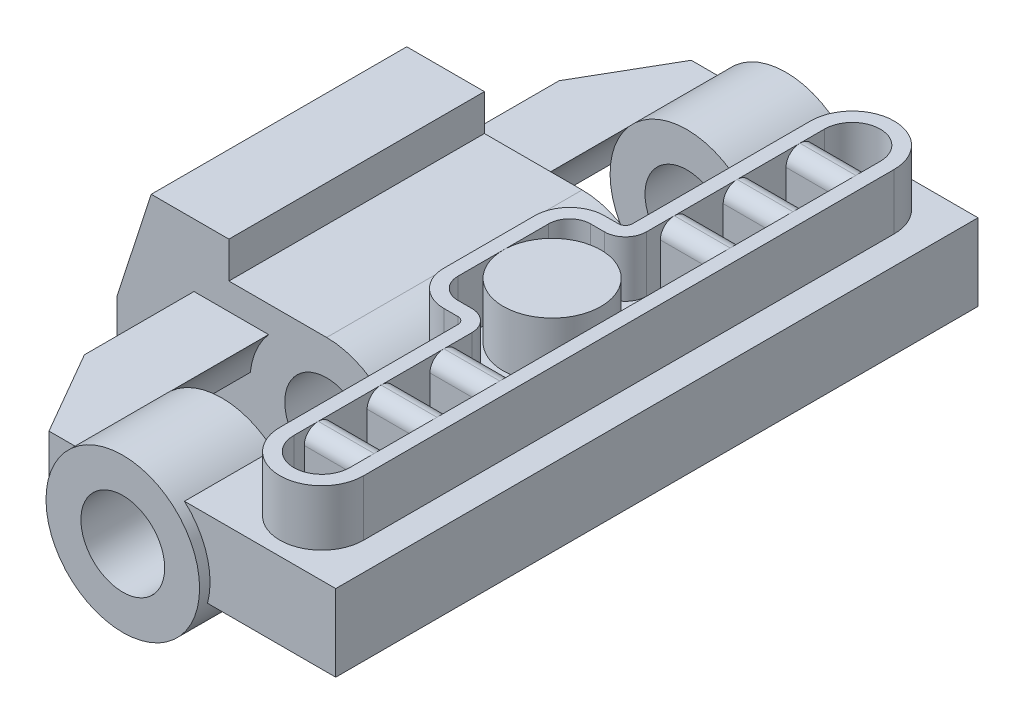
from build123d import *

# Parameters (mm, degrees)
BOSS_EXTRUDE1_DEPTH    = 9.15
BOSS_EXTRUDE2_DEPTH    = 3
BOSS_EXTRUDE3_START    = -23
SKETCH4_R              = 5.5
BOSS_EXTRUDE3_DEPTH    = 23.75
MOVE_START             = 3.6
MOVE_FACE1_OUTLINE_W   = 12.5
MOVE_FACE1_OUTLINE_H   = 46
MOVE_FACE1_DEPTH       = 0.5
MOVE_START_2           = -1.4
MOVE_FACE2_OUTLINE_W   = 10.5
MOVE_FACE2_OUTLINE_H   = 46
MOVE_FACE2_DEPTH       = 2
SKETCH7_R              = 5.5
CUT_EXTRUDE1_DEPTH     = 7.5
HOLE2_START            = -23.75
HOLE2_OUTLINE_R        = 3
HOLE2_DEPTH            = 47.5
BOSS_EXTRUDE4_REACH    = 35.801
SKETCH10_W             = 4
SKETCH10_H             = 11.5
FILLET1_R              = 2.5
FILLET3_R              = 0.5
CUT_EXTRUDE2_DEPTH     = 4
SKETCH12_W             = 6
SKETCH12_H             = 2
BOSS_EXTRUDE5_DEPTH    = 4
FILLET2_R              = 1
LPATTERN2_COUNT        = 3
LPATTERN2_PITCH        = 4.5
FILLET2_OF_LPATTERN2_R = 1
SKETCH13_R             = 3.5
BOSS_EXTRUDE13_DEPTH   = 4
MIRROR1_START          = 7.5
MIRROR1_DEPTH          = 4
MIRROR1_START_2        = 9.15
MIRROR1_2_OUTLINE_R    = 3
MIRROR1_2_DEPTH        = 7.5


# Read off the part's stored shape, not the designer's step: Move Face1, Move Face2, Hole2, Mirror1
# Some blends are built 0.0001 mm under size
with BuildPart() as part:
    # Sketch1 → Boss-Extrude1 (new, symmetric)
    with BuildSketch(Plane.XY):
        with BuildLine():
            Line((-4.4, -5.5), (0, -5.5))
            ThreePointArc((0, -5.5), (5.5, 0), (0, 5.5))
            Line((0, 5.5), (-7, 5.5))
            Line((-7, 5.5), (-7, 8.1))
            Line((-7, 8.1), (-12.563102278, 8.1))
            Line((-12.563102278, 8.1), (-15, 0.6))
            Line((-15, 0.6), (-15, -8.830934004))
            Line((-15, -8.830934004), (-4.4, -10.7))
            Line((-4.4, -10.7), (-4.4, -5.5))
        make_face()
    extrude(amount=BOSS_EXTRUDE1_DEPTH, both=True)

    # Sketch3 → Boss-Extrude2 (add)
    with BuildSketch(Plane(origin=(0, 0.6, 0), x_dir=(0, 0, -1), z_dir=(0, 1, 0))):
        Polygon((17, 9.5), (-17, 9.5), (-23, 6.035898385), (-23, -14.5), (23, -14.5), (23, 6.035898385), align=None)
    extrude(amount=BOSS_EXTRUDE2_DEPTH)

    # Sketch4 → Boss-Extrude3 (add, symmetric)
    with BuildSketch(Plane(origin=(0, 0, -23), x_dir=(-1, 0, 0), z_dir=(0, 0, -1)).offset(BOSS_EXTRUDE3_START)):
        with Locations(Location((0, 0, 0), (0, 0, 180))):
            Circle(SKETCH4_R)
    extrude(amount=BOSS_EXTRUDE3_DEPTH, both=True)

    # Move Face1 outline → Move Face1 (add)
    with BuildSketch(Plane(origin=(0, 0, 0), x_dir=(1, 0, 0), z_dir=(0, 1, 0)).offset(MOVE_START)):
        with Locations((8.25, 0)):
            Rectangle(MOVE_FACE1_OUTLINE_W, MOVE_FACE1_OUTLINE_H)
    extrude(amount=MOVE_FACE1_DEPTH)

    # Move Face2 outline → Move Face2 (add)
    with BuildSketch(Plane(origin=(0, 0, 0), x_dir=(1, 0, 0), z_dir=(0, 1, 0)).offset(MOVE_START_2)):
        with Locations((9.25, 0)):
            Rectangle(MOVE_FACE2_OUTLINE_W, MOVE_FACE2_OUTLINE_H)
    extrude(amount=MOVE_FACE2_DEPTH)

    # Sketch7 → Cut-Extrude1 (cut)
    with BuildSketch(Plane(origin=(0, 0, -9.15), x_dir=(-1, 0, 0), z_dir=(0, 0, -1))):
        with Locations(Location((0, 0, 0), (0, 0, 6.262913126))):
            Circle(SKETCH7_R)
    extrude(amount=CUT_EXTRUDE1_DEPTH, mode=Mode.SUBTRACT)

    # Hole2 outline → Hole2 (cut)
    with BuildSketch(Plane.XY.offset(HOLE2_START)):
        Circle(HOLE2_OUTLINE_R)
    extrude(amount=HOLE2_DEPTH, mode=Mode.SUBTRACT)

    # Boss-Extrude4: up to this face of the body (flat: up to its plane)
    boss_extrude4_end = Plane(part.part.faces().sort_by_distance((9.083030278, 4.1, 0))[0])
    # Sketch10 → Boss-Extrude4 (add, up to the picked face)
    with BuildSketch(Plane(origin=(0, 8.1, 0), x_dir=(1, 0, 0), z_dir=(0, 1, 0)), mode=Mode.PRIVATE) as boss_extrude4_sk1:
        with BuildLine():
            Line((12.5, -19), (12.5, 19))
            ThreePointArc((12.5, 19), (9.5, 22), (6.5, 19))
            Line((6.5, 19), (6.5, 5.75))
            Line((6.5, 5.75), (10.5, 5.75))
            Line((10.5, 5.75), (10.5, -5.75))
            Line((10.5, -5.75), (6.5, -5.75))
            Line((6.5, -5.75), (6.5, -19))
            ThreePointArc((6.5, -19), (9.5, -22), (12.5, -19))
        make_face()
    boss_extrude4_tool1 = split(extrude(boss_extrude4_sk1.sketch, amount=-BOSS_EXTRUDE4_REACH, mode=Mode.PRIVATE), bisect_by=boss_extrude4_end, keep=Keep.BOTH, mode=Mode.PRIVATE)
    # Sketch10 → Boss-Extrude4 (add, up to the picked face)
    with BuildSketch(Plane(origin=(0, 8.1, 0), x_dir=(1, 0, 0), z_dir=(0, 1, 0)), mode=Mode.PRIVATE) as boss_extrude4_sk2:
        with Locations((8.5, 0)):
            Rectangle(SKETCH10_W, SKETCH10_H)
    boss_extrude4_tool2 = split(extrude(boss_extrude4_sk2.sketch, amount=-BOSS_EXTRUDE4_REACH, mode=Mode.PRIVATE), bisect_by=boss_extrude4_end, keep=Keep.BOTH, mode=Mode.PRIVATE)
    # Sketch10 → Boss-Extrude4 (add, up to the picked face)
    with BuildSketch(Plane(origin=(0, 8.1, 0), x_dir=(1, 0, 0), z_dir=(0, 1, 0)), mode=Mode.PRIVATE) as boss_extrude4_sk3:
        with Locations((4.5, 0)):
            Rectangle(SKETCH10_W, SKETCH10_H)
    boss_extrude4_tool3 = split(extrude(boss_extrude4_sk3.sketch, amount=-BOSS_EXTRUDE4_REACH, mode=Mode.PRIVATE), bisect_by=boss_extrude4_end, keep=Keep.BOTH, mode=Mode.PRIVATE)
    add(boss_extrude4_tool1.solids().sort_by(Axis((12.055928, 8.1, 0), (0, -1, 0)))[0])
    add(boss_extrude4_tool2.solids().sort_by(Axis((8.5, 8.1, 0), (0, -1, 0)))[0])
    add(boss_extrude4_tool3.solids().sort_by(Axis((4.5, 8.1, 0), (0, -1, 0)))[0])

    # Fillet1
    # the kernel refuses this fillet: 2.5 mm, written as the material it takes off along each edge
    with BuildSketch(Plane(origin=(2.5, 14.35, -5.75), x_dir=(1, 0, 0), z_dir=(0, -1, 0))) as fillet1_piece_1_section:
        with BuildLine():
            CenterArc((FILLET1_R, FILLET1_R), FILLET1_R, 180, 90)
            Line((0, FILLET1_R), (0, 0))
            Line((0, 0), (FILLET1_R, 0))
        make_face()
    fillet1_piece_1 = extrude(amount=15.701020514, mode=Mode.PRIVATE)
    fillet1_piece_1 = fillet1_piece_1 - Plane(origin=(0, 0, -5.193529693), x_dir=(0, -1, 0), z_dir=(0, 0, 1)) * Cylinder(5.5, 42, mode=Mode.PRIVATE)
    fillet1_piece_1 = split(fillet1_piece_1, bisect_by=Plane(origin=(3.08088975, 4.1, -5.193529693), z_dir=(0, 1, 0)), keep=Keep.TOP, mode=Mode.PRIVATE)
    add(fillet1_piece_1, mode=Mode.SUBTRACT)
    with BuildSketch(Plane(origin=(2.5, 14.35, 5.75), x_dir=(0, 0, -1), z_dir=(0, -1, 0))) as fillet1_piece_2_section:
        with BuildLine():
            CenterArc((FILLET1_R, FILLET1_R), FILLET1_R, 180, 90)
            Line((0, FILLET1_R), (0, 0))
            Line((0, 0), (FILLET1_R, 0))
        make_face()
    fillet1_piece_2 = extrude(amount=15.701020514, mode=Mode.PRIVATE)
    fillet1_piece_2 = fillet1_piece_2 - Plane(origin=(0, 0, 5.193529696), x_dir=(0, -1, 0), z_dir=(0, 0, 1)) * Cylinder(5.5, 42, mode=Mode.PRIVATE)
    fillet1_piece_2 = split(fillet1_piece_2, bisect_by=Plane(origin=(3.080889748, 4.1, 5.193529696), z_dir=(0, 1, 0)), keep=Keep.TOP, mode=Mode.PRIVATE)
    add(fillet1_piece_2, mode=Mode.SUBTRACT)

    # Fillet3
    fillet3_edges = [part.edges().sort_by_distance(p)[0] for p in [
        (6.5, 6.1, 5.75),
        (6.5, 6.1, -5.75),
    ]]
    fillet(fillet3_edges, radius=FILLET3_R)

    # Sketch11 → Cut-Extrude2 (cut)
    with BuildSketch(Plane(origin=(0, 8.1, 0), x_dir=(1, 0, 0), z_dir=(0, 1, 0))):
        with BuildLine():
            Line((6, 4.75), (5, 4.75))
            ThreePointArc((5, 4.75), (3.939339828, 4.310660172), (3.5, 3.25))
            Line((3.5, 3.25), (3.5, -3.25))
            ThreePointArc((3.5, -3.25), (3.939339828, -4.310660172), (5, -4.75))
            Line((5, -4.75), (6, -4.75))
            ThreePointArc((6, -4.75), (7.060660172, -5.189339828), (7.5, -6.25))
            Line((7.5, -6.25), (7.5, -19))
            ThreePointArc((7.5, -19), (9.5, -21), (11.5, -19))
            Line((11.5, -19), (11.5, 19))
            ThreePointArc((11.5, 19), (9.5, 21), (7.5, 19))
            Line((7.5, 19), (7.5, 6.25))
            ThreePointArc((7.5, 6.25), (7.060660172, 5.189339828), (6, 4.75))
        make_face()
    extrude(amount=-CUT_EXTRUDE2_DEPTH, mode=Mode.SUBTRACT)

    # Sketch12 → Boss-Extrude5 (add)
    with BuildSketch(Plane(origin=(0, 4.1, 0), x_dir=(1, 0, 0), z_dir=(0, 1, 0))):
        with Locations((9.5, 17.25)):
            Rectangle(SKETCH12_W, SKETCH12_H)
    boss_extrude5 = extrude(amount=BOSS_EXTRUDE5_DEPTH)

    # Fillet2
    fillet2_edges = [part.edges().sort_by_distance(p)[0] for p in [
        (9.5, 8.1, -18.25),
        (9.5, 8.1, -16.25),
    ]]
    fillet(fillet2_edges, radius=FILLET2_R - 0.0001)  # a hair under: the kernel refuses the full size

    # LPattern2: Boss-Extrude5 ×3
    with Locations(*[(0, 0, i * LPATTERN2_PITCH) for i in range(1, LPATTERN2_COUNT)]):
        add(boss_extrude5)

    # Fillet2 of LPattern2
    fillet2_of_lpattern2_edges = [part.edges().sort_by_distance(p)[0] for p in [
        (9.5, 8.1, -13.75),
        (9.5, 8.1, -11.75),
        (9.5, 8.1, -9.25),
        (9.5, 8.1, -7.25),
    ]]
    fillet(fillet2_of_lpattern2_edges, radius=FILLET2_OF_LPATTERN2_R - 0.0001)  # a hair under: the kernel refuses the full size

    # Sketch13 → Boss-Extrude13 (add)
    with BuildSketch(Plane(origin=(0, 4.1, 0), x_dir=(1, 0, 0), z_dir=(0, 1, 0))):
        with Locations(Location((7.00001, 0, 0), (0, 0, 270))):
            Circle(SKETCH13_R)
    extrude(amount=BOSS_EXTRUDE13_DEPTH)

    # Mirror1 outline → Mirror1 (add)
    with BuildSketch(Plane.YZ.offset(MIRROR1_START)):
        with BuildLine():
            ThreePointArc((8.1, 17.25), (7.807106781, 17.957106781), (7.1, 18.25))
            Line((7.1, 18.25), (4.1, 18.25))
            Line((4.1, 18.25), (4.1, 16.25))
            Line((4.1, 16.25), (7.1, 16.25))
            ThreePointArc((7.1, 16.25), (7.807106781, 16.542893219), (8.1, 17.25))
        make_face()
        with BuildLine():
            Line((7.1, 9.25), (4.1, 9.25))
            Line((4.1, 9.25), (4.1, 7.25))
            Line((4.1, 7.25), (7.1, 7.25))
            ThreePointArc((7.1, 7.25), (7.807106781, 7.542893219), (8.1, 8.25))
            ThreePointArc((8.1, 8.25), (7.807106781, 8.957106781), (7.1, 9.25))
        make_face()
        with BuildLine():
            Line((7.1, 13.75), (4.1, 13.75))
            Line((4.1, 13.75), (4.1, 11.75))
            Line((4.1, 11.75), (7.1, 11.75))
            ThreePointArc((7.1, 11.75), (7.807106781, 12.042893219), (8.1, 12.75))
            ThreePointArc((8.1, 12.75), (7.807106781, 13.457106781), (7.1, 13.75))
        make_face()
    extrude(amount=MIRROR1_DEPTH)

    # Mirror1 2 outline → Mirror1 2 (cut)
    with BuildSketch(Plane.XY.offset(MIRROR1_START_2)):
        with BuildLine():
            ThreePointArc((5.318834459, -1.4), (5.267312845, 1.582850401), (3.666060556, 4.1))
            ThreePointArc((3.666060556, 4.1), (-0.350758821, 5.4888039), (-4.158124577, 3.6))
            ThreePointArc((-4.158124577, 3.6), (-5.040991658, 2.199637039), (-5.467174773, 0.6))
            ThreePointArc((-5.467174773, 0.6), (-1.002746834, -5.407818302), (5.318834459, -1.4))
        make_face()
        Circle(MIRROR1_2_OUTLINE_R, mode=Mode.SUBTRACT)
    extrude(amount=MIRROR1_2_DEPTH, mode=Mode.SUBTRACT)


solid = part.part
